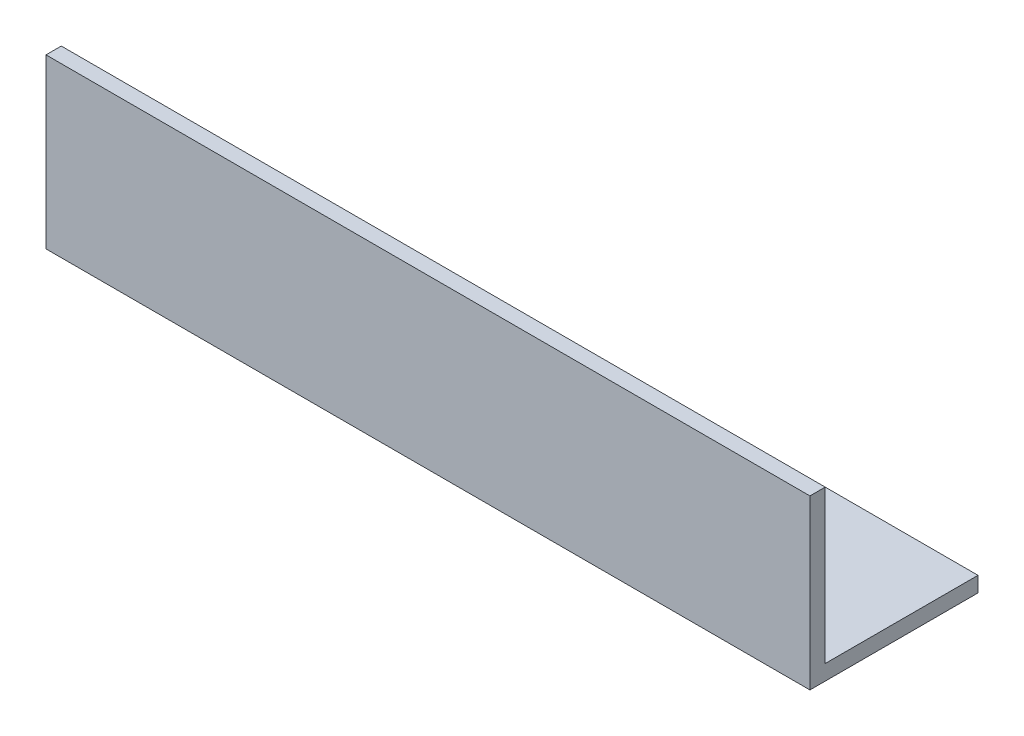
from build123d import *

# Parameters (mm, degrees)
EXTRUDE_1_DEPTH     = 150
SKETCH_2_R          = 5
CUT_EXTRUDE_1_DEPTH = 157.489616269


with BuildPart() as part:
    # Эскиз1 → Вытянуть-Тонкостенный1 (new body)
    with BuildSketch(Plane(origin=(0, 0, 0), x_dir=(0, 0, -1), z_dir=(1, 0, 0))):
        Polygon((30, 0), (0, 0), (0, 30), (-3, 30), (-3, -3), (30, -3), align=None)
    extrude(amount=EXTRUDE_1_DEPTH)

    # Эскиз2 → Вырез-Вытянуть1 (cut, through all)
    with BuildSketch(Plane.XZ.offset(3)):
        with Locations((130, -12)):
            Circle(SKETCH_2_R)
        with Locations((100, -12)):
            Circle(SKETCH_2_R)
        with Locations((50, -12)):
            Circle(SKETCH_2_R)
        with Locations((20, -12)):
            Circle(SKETCH_2_R)
    extrude(amount=-CUT_EXTRUDE_1_DEPTH, mode=Mode.SUBTRACT)


solid = part.part
